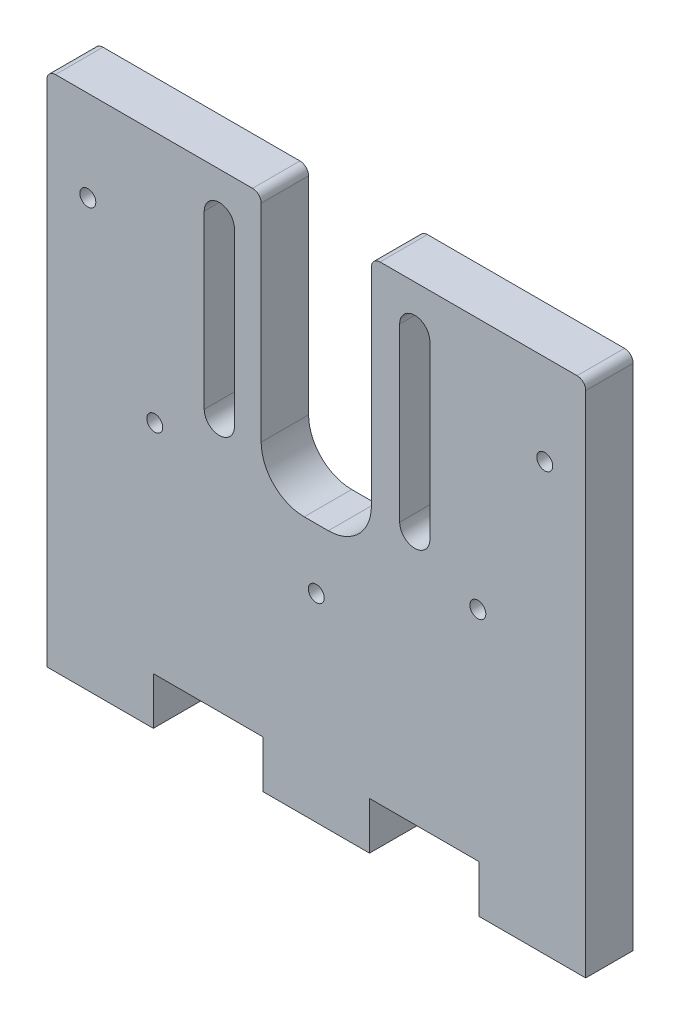
from build123d import *

# Parameters (mm, degrees)
SKETCH2_R           = 1.85
BOSS_EXTRUDE7_DEPTH = 11


with BuildPart() as part:
    # Sketch2 → Boss-Extrude7 (new body)
    with BuildSketch(Plane.XY):
        with BuildLine():
            Line((-0.187241808, 0), (-0.187241808, 118))
            ThreePointArc((-0.187241808, 118), (0.39854463, 119.414213562), (1.812758192, 120))
            Line((1.812758192, 120), (47.525402111, 120))
            ThreePointArc((47.525402111, 120), (48.939615673, 119.414213562), (49.525402111, 118))
            Line((49.525402111, 118), (49.525402111, 70))
            ThreePointArc((49.525402111, 70), (52.454334299, 62.928932188), (59.525402111, 60))
            Line((59.525402111, 60), (65.100114274, 60))
            ThreePointArc((65.100114274, 60), (72.171182086, 62.928932188), (75.100114274, 70))
            Line((75.100114274, 70), (75.100114274, 118))
            ThreePointArc((75.100114274, 118), (75.685900711, 119.414213562), (77.100114274, 120))
            Line((77.100114274, 120), (122.812758192, 120))
            ThreePointArc((122.812758192, 120), (124.226971755, 119.414213562), (124.812758192, 118))
            Line((124.812758192, 118), (124.812758192, 0))
            Line((124.812758192, 0), (100.112758192, 0))
            Line((100.112758192, 0), (100.112758192, 11))
            Line((100.112758192, 11), (74.662758192, 11))
            Line((74.662758192, 11), (74.662758192, 0))
            Line((74.662758192, 0), (49.962758192, 0))
            Line((49.962758192, 0), (49.962758192, 11))
            Line((49.962758192, 11), (24.512758192, 11))
            Line((24.512758192, 11), (24.512758192, 0))
            Line((24.512758192, 0), (-0.187241808, 0))
        make_face()
        with Locations((62.312758192, 46)):
            Circle(SKETCH2_R, mode=Mode.SUBTRACT)
        with Locations((24.836098789, 61.523340597)):
            Circle(SKETCH2_R, mode=Mode.SUBTRACT)
        with Locations((9.312758192, 99)):
            Circle(SKETCH2_R, mode=Mode.SUBTRACT)
        with Locations((115.312758192, 99)):
            Circle(SKETCH2_R, mode=Mode.SUBTRACT)
        with Locations((99.789417595, 61.523340597)):
            Circle(SKETCH2_R, mode=Mode.SUBTRACT)
        with BuildLine():
            Line((36.312758192, 70), (36.312758192, 109.809569657))
            ThreePointArc((36.312758192, 109.809569657), (39.812758192, 113.309569657), (43.312758192, 109.809569657))
            Line((43.312758192, 109.809569657), (43.312758192, 70))
            ThreePointArc((43.312758192, 70), (39.812758192, 66.5), (36.312758192, 70))
        make_face(mode=Mode.SUBTRACT)
        with BuildLine():
            Line((88.656580938, 70), (88.656580938, 109.809569657))
            ThreePointArc((88.656580938, 109.809569657), (85.156580938, 113.309569657), (81.656580938, 109.809569657))
            Line((81.656580938, 109.809569657), (81.656580938, 70))
            ThreePointArc((81.656580938, 70), (85.156580938, 66.5), (88.656580938, 70))
        make_face(mode=Mode.SUBTRACT)
    extrude(amount=BOSS_EXTRUDE7_DEPTH)


solid = part.part
